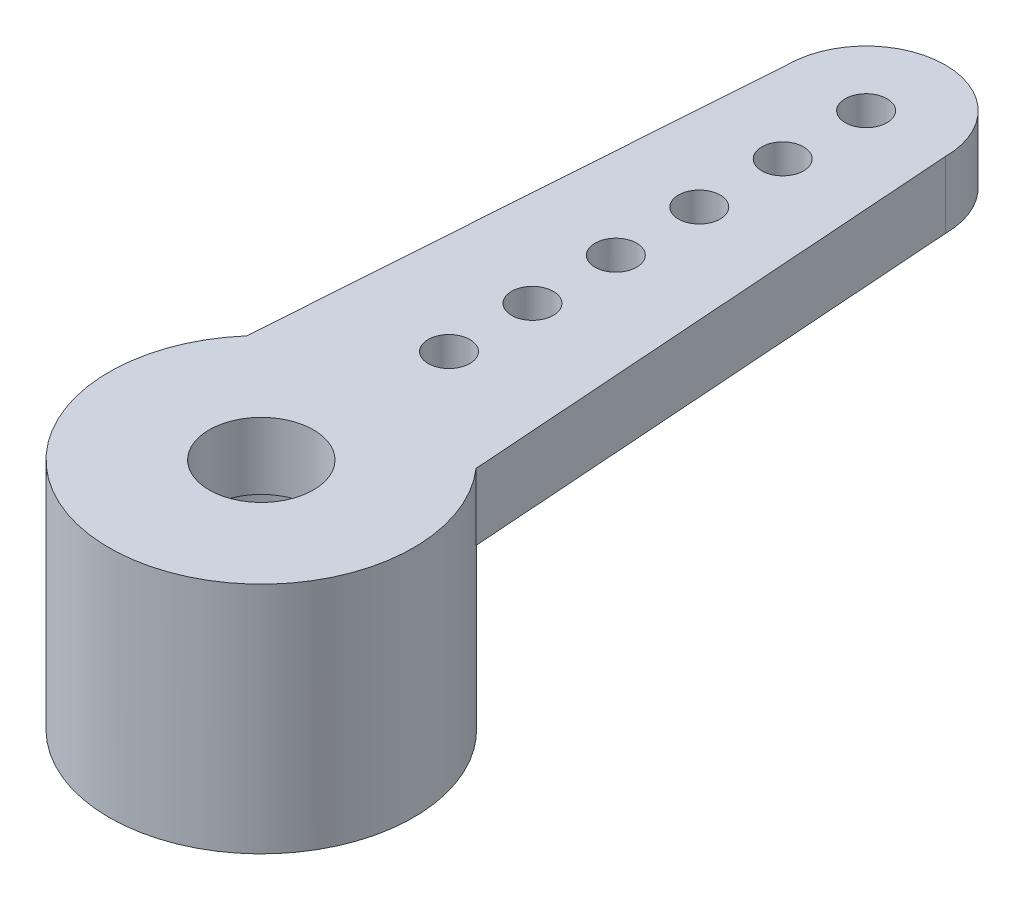
from build123d import *
from build123d.topology import SkipClean

# Parameters (mm, degrees)
SKETCH1_R           = 3.65
SKETCH1_R_2         = 2.5
BOSS_EXTRUDE1_DEPTH = 4
SKETCH2_R           = 1.25
BOSS_EXTRUDE2_DEPTH = 1.6
CUT_EXTRUDE1_REACH  = 19.71
SKETCH3_R           = 0.5


with BuildPart() as part:
    # Sketch1 → Boss-Extrude1 (new body)
    with BuildSketch(Plane(origin=(0, 0, 0), x_dir=(1, 0, 0), z_dir=(0, 1, 0))):
        Circle(SKETCH1_R)
        Circle(SKETCH1_R_2, mode=Mode.SUBTRACT)
    extrude(amount=BOSS_EXTRUDE1_DEPTH)

    # Sketch2 → Boss-Extrude2 (add)
    with SkipClean():  # the faces are left unmerged after this step: merging them gives an invalid solid
        with BuildSketch(Plane(origin=(0, 4, 0), x_dir=(1, 0, 0), z_dir=(0, 1, 0))):
            with BuildLine():
                Line((-2.75, 2.4), (-1.9, 14.5))
                ThreePointArc((-1.9, 14.5), (0, 16.4), (1.9, 14.5))
                Line((1.9, 14.5), (2.75, 2.4))
                ThreePointArc((2.75, 2.4), (0, -3.65), (-2.75, 2.4))
            make_face()
            Circle(SKETCH2_R, mode=Mode.SUBTRACT)
        extrude(amount=BOSS_EXTRUDE2_DEPTH)
    add(part.part.scale(1), mode=Mode.REPLACE)  # the faces are merged on a copy

    # Sketch3 → Cut-Extrude1 (cut, up to next)
    with BuildSketch(Plane(origin=(0, 5.6, 0), x_dir=(1, 0, 0), z_dir=(0, 1, 0)), mode=Mode.PRIVATE) as cut_extrude1_sk1:
        with Locations((0, 12.5)):
            Circle(SKETCH3_R)
    cut_extrude1_tool1 = extrude(cut_extrude1_sk1.sketch, amount=-CUT_EXTRUDE1_REACH, mode=Mode.PRIVATE) & part.part
    # Sketch3 → Cut-Extrude1 (cut, up to next)
    with BuildSketch(Plane(origin=(0, 5.6, 0), x_dir=(1, 0, 0), z_dir=(0, 1, 0)), mode=Mode.PRIVATE) as cut_extrude1_sk2:
        with Locations((0, 10.5)):
            Circle(SKETCH3_R)
    cut_extrude1_tool2 = extrude(cut_extrude1_sk2.sketch, amount=-CUT_EXTRUDE1_REACH, mode=Mode.PRIVATE) & part.part
    # Sketch3 → Cut-Extrude1 (cut, up to next)
    with BuildSketch(Plane(origin=(0, 5.6, 0), x_dir=(1, 0, 0), z_dir=(0, 1, 0)), mode=Mode.PRIVATE) as cut_extrude1_sk3:
        with Locations((0, 14.5)):
            Circle(SKETCH3_R)
    cut_extrude1_tool3 = extrude(cut_extrude1_sk3.sketch, amount=-CUT_EXTRUDE1_REACH, mode=Mode.PRIVATE) & part.part
    # Sketch3 → Cut-Extrude1 (cut, up to next)
    with BuildSketch(Plane(origin=(0, 5.6, 0), x_dir=(1, 0, 0), z_dir=(0, 1, 0)), mode=Mode.PRIVATE) as cut_extrude1_sk4:
        with Locations((0, 8.5)):
            Circle(SKETCH3_R)
    cut_extrude1_tool4 = extrude(cut_extrude1_sk4.sketch, amount=-CUT_EXTRUDE1_REACH, mode=Mode.PRIVATE) & part.part
    # Sketch3 → Cut-Extrude1 (cut, up to next)
    with BuildSketch(Plane(origin=(0, 5.6, 0), x_dir=(1, 0, 0), z_dir=(0, 1, 0)), mode=Mode.PRIVATE) as cut_extrude1_sk5:
        with Locations((0, 6.5)):
            Circle(SKETCH3_R)
    cut_extrude1_tool5 = extrude(cut_extrude1_sk5.sketch, amount=-CUT_EXTRUDE1_REACH, mode=Mode.PRIVATE) & part.part
    # Sketch3 → Cut-Extrude1 (cut, up to next)
    with BuildSketch(Plane(origin=(0, 5.6, 0), x_dir=(1, 0, 0), z_dir=(0, 1, 0)), mode=Mode.PRIVATE) as cut_extrude1_sk6:
        with Locations((0, 4.5)):
            Circle(SKETCH3_R)
    cut_extrude1_tool6 = extrude(cut_extrude1_sk6.sketch, amount=-CUT_EXTRUDE1_REACH, mode=Mode.PRIVATE) & part.part
    add(cut_extrude1_tool1.solids().sort_by_distance((0, 5.6, -12.5))[0], mode=Mode.SUBTRACT)
    add(cut_extrude1_tool2.solids().sort_by_distance((0, 5.6, -10.5))[0], mode=Mode.SUBTRACT)
    add(cut_extrude1_tool3.solids().sort_by_distance((0, 5.6, -14.5))[0], mode=Mode.SUBTRACT)
    add(cut_extrude1_tool4.solids().sort_by_distance((0, 5.6, -8.5))[0], mode=Mode.SUBTRACT)
    add(cut_extrude1_tool5.solids().sort_by_distance((0, 5.6, -6.5))[0], mode=Mode.SUBTRACT)
    add(cut_extrude1_tool6.solids().sort_by_distance((0, 5.6, -4.5))[0], mode=Mode.SUBTRACT)


solid = part.part
